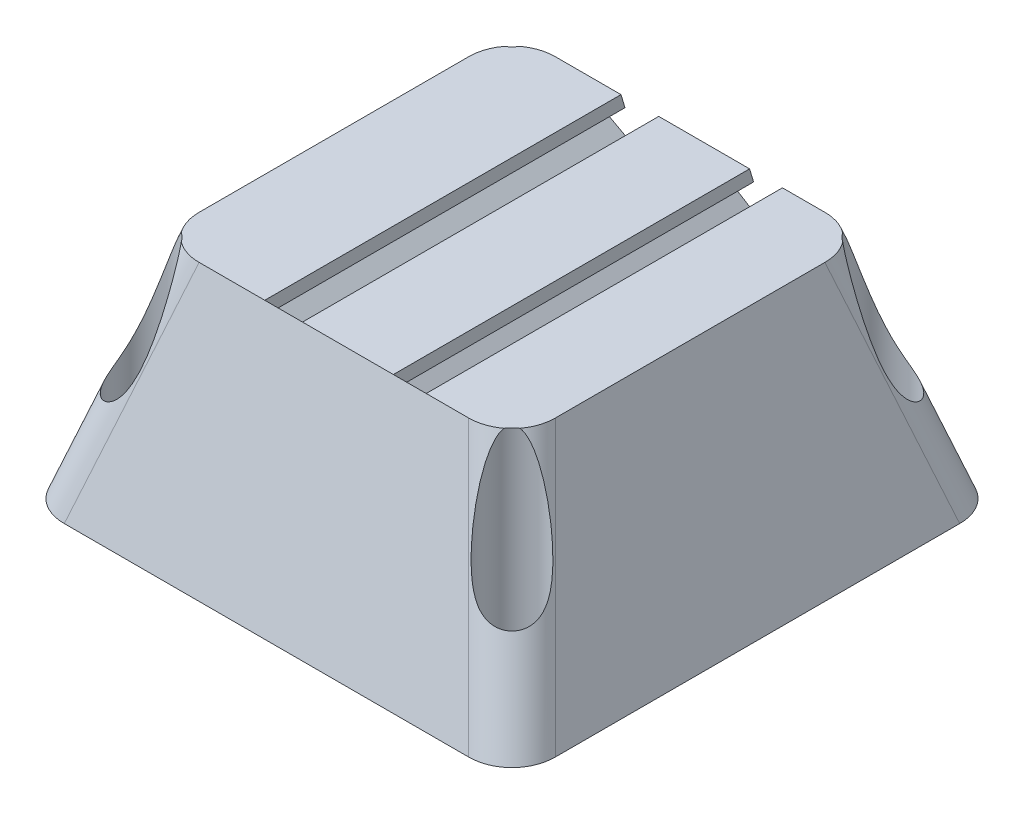
from build123d import *

# Parameters (mm, degrees)
SURFACE_FILL2_OUTLINE_W = 40
SURFACE_FILL2_OUTLINE_H = 40
SURFACE_FILL2_DEPTH     = 25.4
SURFACE_FILL2_DRAFT     = 16.595714
FILLET2_R               = 5.08
CUT_EXTRUDE3_DEPTH      = 47.53353416
CUT_EXTRUDE3_DEPTH_BACK = 47.53353416
SKETCH11_R              = 3.25
CUT_EXTRUDE4_START      = -41.921317507
CUT_EXTRUDE4_DEPTH      = 41.921317507


# Read off the part's stored shape, not the designer's step: Surface-Fill2, Cut-Extrude4
with BuildPart() as part:
    # Surface-Fill2 outline → Surface-Fill2 (with draft: the straight prism first)
    with BuildSketch(Plane(origin=(0, 25.4, 0), x_dir=(1, 0, 0), z_dir=(0, 1, 0))):
        Rectangle(SURFACE_FILL2_OUTLINE_W, SURFACE_FILL2_OUTLINE_H)
    extrude(amount=-SURFACE_FILL2_DEPTH)
    # Surface-Fill2: the draft: its side faces are tilted about the plane it starts from
    surface_fill2_sides = [part.faces().sort_by_distance(p)[0] for p in [
        (-20, 12.7, 0),
        (0, 12.7, 20),
        (20, 12.7, 0),
        (0, 12.7, -20),
    ]]
    draft(surface_fill2_sides, Plane(origin=(0, 25.4, 0), x_dir=(1, 0, 0), z_dir=(0, 1, 0)), SURFACE_FILL2_DRAFT)

    # Fillet2
    fillet2_edges = [part.edges().sort_by_distance(p)[0] for p in [
        (23.785000007, 12.7, -23.785000007),
        (23.785000007, 12.7, 23.785000007),
        (-23.785000007, 12.7, -23.785000007),
        (-23.785000007, 12.7, 23.785000007),
    ]]
    fillet(fillet2_edges, radius=FILLET2_R)

    # Sketch11 → Cut-Extrude3 (cut, two sides: drawn at the far end of the back side and taken through both)
    with BuildSketch(Plane(origin=(0, 0, 0), x_dir=(1, 0, 0), z_dir=(0, 1, 0)).offset(-CUT_EXTRUDE3_DEPTH_BACK)):
        with Locations(Location((-20.82, 20.82, 0), (0, 0, 326.308545858))):
            Circle(SKETCH11_R)
        with Locations(Location((20.82, 20.82, 0), (0, 0, 213.691454142))):
            Circle(SKETCH11_R)
        with Locations(Location((-20.82, -20.82, 0), (0, 0, 56.308545858))):
            Circle(SKETCH11_R)
        with Locations(Location((20.82, -20.82, 0), (0, 0, 123.691454142))):
            Circle(SKETCH11_R)
    extrude(amount=CUT_EXTRUDE3_DEPTH + CUT_EXTRUDE3_DEPTH_BACK, mode=Mode.SUBTRACT)

    # Cut-Extrude4 outline → Cut-Extrude4 (cut)
    with BuildSketch(Plane.XY.offset(20).offset(CUT_EXTRUDE4_START)):
        Polygon((13.737759609, 22.31), (13.737759609, 23.9), (10.367759609, 23.9), (10.367759609, 25.4), (6.679239208, 25.4), (6.679239208, 23.9), (3.309239208, 23.9), (3.309239208, 22.31), (6.138499409, 18.953307175), (10.908499409, 18.953307175), align=None)
        Polygon((-3.523215232, 23.9), (-3.523215232, 25.4), (-7.761612771, 25.4), (-7.761612771, 23.9), (-11.131612771, 23.9), (-11.131612771, 22.31), (-8.027414001, 19.205801231), (-3.257414001, 19.205801231), (-0.153215232, 22.31), (-0.153215232, 23.9), align=None)
    extrude(amount=CUT_EXTRUDE4_DEPTH, mode=Mode.SUBTRACT)


solid = part.part
